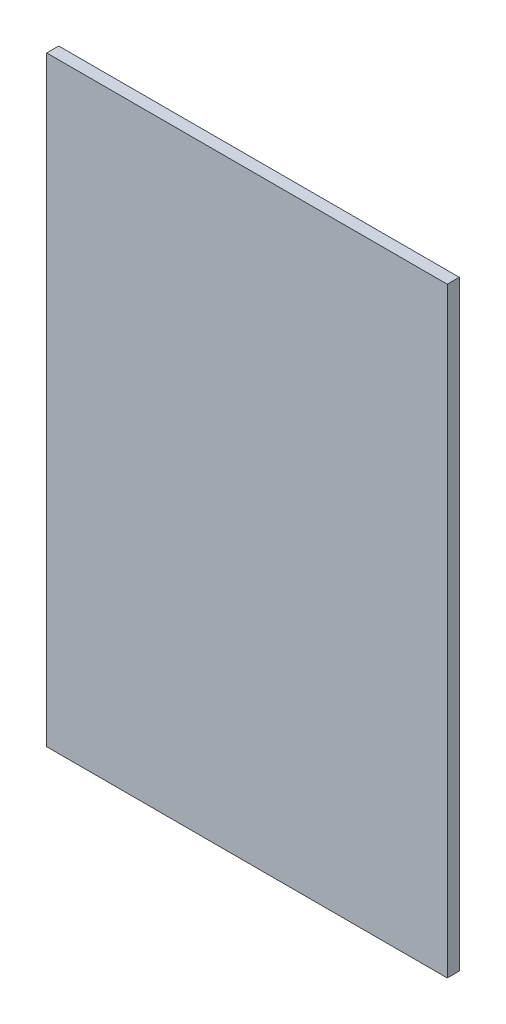
from build123d import *

# Parameters (mm, degrees)
SKETCH1_W           = 200
SKETCH1_H           = 300
BOSS_EXTRUDE1_DEPTH = 6


with BuildPart() as part:
    # Sketch1 → Boss-Extrude1 (new body)
    with BuildSketch(Plane.XY):
        with Locations((71.428571429, 127.104761905)):
            Rectangle(SKETCH1_W, SKETCH1_H)
    extrude(amount=BOSS_EXTRUDE1_DEPTH)


solid = part.part
